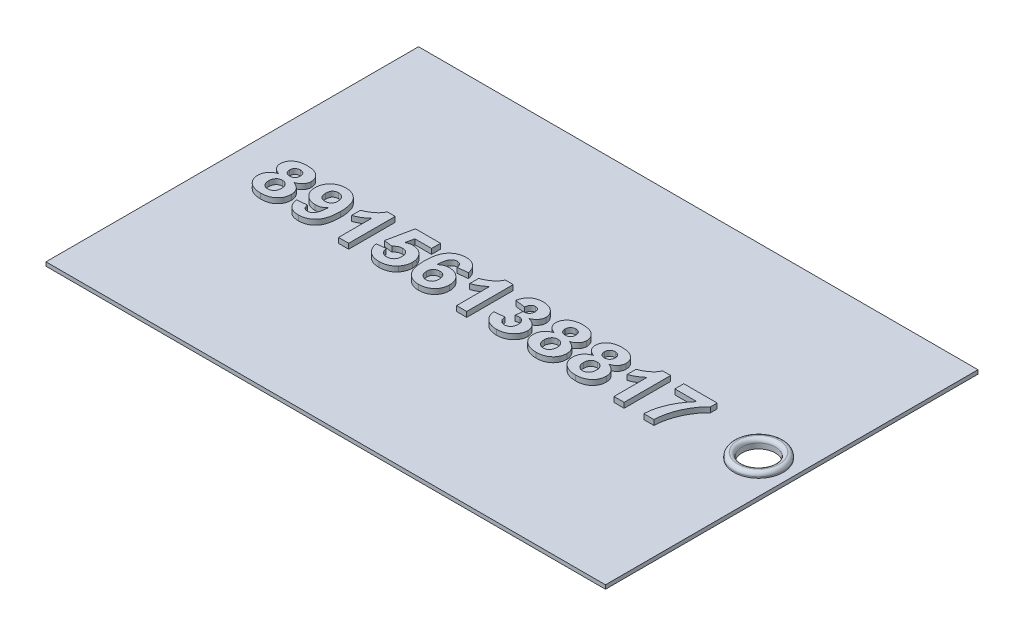
from build123d import *

# Parameters (mm, degrees)
SKETCH_1_W          = 86.5
SKETCH_1_H          = 57.6
EXTRUDE_1_DEPTH     = 0.6
EXTRUDE_2_DEPTH     = 0.8
SKETCH_4_R          = 3.817561334
EXTRUDE_3_DEPTH     = 0.8
SKETCH_6_R          = 2.57898752
CUT_EXTRUDE_1_DEPTH = 1.8
FILLET_1_R          = 0.6


with BuildPart() as part:
    # Эскиз1 → Бобышка-Вытянуть1 (new body)
    with BuildSketch(Plane(origin=(0, 0, 0), x_dir=(1, 0, 0), z_dir=(0, 1, 0))):
        Rectangle(SKETCH_1_W, SKETCH_1_H)
    extrude(amount=EXTRUDE_1_DEPTH)

    # Эскиз2 → Бобышка-Вытянуть2 (add)
    # profile 1 of 11: a face of its own
    with BuildSketch(Plane(origin=(0, 0.6, 0), x_dir=(1, 0, 0), z_dir=(0, 1, 0))):
        with BuildLine():
            add(Edge.make_bspline(
                [(-36.285548398, 0.189662229), (-36.336217326, 0.208249515), (-36.435329018, 0.244607445), (-36.576636112, 0.308436742), (-36.707435743, 0.376604952), (-36.826370801, 0.451592864), (-36.937086754, 0.528059561), (-37.034487713, 0.614103649), (-37.123125063, 0.70282966), (-37.224040922, 0.827712646), (-37.328587221, 0.991967456), (-37.416710796, 1.203180728), (-37.475337374, 1.422983015), (-37.481160232, 1.574149403), (-37.484097118, 1.650393481)],
                knots=[0, 0, 0, 0, 0.958286053, 1.874469368, 2.751924474, 3.575500876, 4.37063306, 5.138446985, 5.88024205, 6.595529584, 7.986847543, 9.320617915, 10.648594961, 12, 12, 12, 12], degree=3))
            add(Edge.make_bspline(
                [(-37.484097118, 1.650393481), (-37.482090341, 1.714839157), (-37.478146025, 1.841506974), (-37.449070542, 2.027277931), (-37.399284622, 2.204302041), (-37.332164765, 2.373660858), (-37.243122203, 2.533595618), (-37.133650181, 2.683858537), (-37.006933234, 2.82689857), (-36.860638307, 2.959716616), (-36.696842178, 3.080367811), (-36.515708278, 3.18664285), (-36.316738031, 3.27331835), (-36.102845759, 3.347967004), (-35.871471108, 3.402834049), (-35.624587499, 3.443454052), (-35.361118613, 3.465853718), (-35.180195806, 3.469425628), (-35.086999679, 3.471265574)],
                knots=[0, 0, 0, 0, 0.914682978, 1.797807145, 2.66113592, 3.520634732, 4.378049579, 5.252103346, 6.155026356, 7.086322986, 8.051602039, 9.038352878, 10.060630283, 11.127721113, 12.250325884, 13.431504408, 14.676928322, 16, 16, 16, 16], degree=3))
            add(Edge.make_bspline(
                [(-35.086999679, 3.471265574), (-34.994763518, 3.469415878), (-34.815279083, 3.46581651), (-34.553732859, 3.443440745), (-34.30825552, 3.402901597), (-34.077973469, 3.347648698), (-33.864746878, 3.27375674), (-33.666356278, 3.185882245), (-33.484369219, 3.080462965), (-33.319151911, 2.959731844), (-33.171535421, 2.826857625), (-33.043111098, 2.684362502), (-32.933970342, 2.533173195), (-32.843322986, 2.373768387), (-32.774425848, 2.204595456), (-32.725021175, 2.027245339), (-32.695829052, 1.841515542), (-32.691900829, 1.714842046), (-32.689902239, 1.650393481)],
                knots=[0, 0, 0, 0, 1.310519152, 2.550168893, 3.725584358, 4.842483071, 5.910449356, 6.927336827, 7.920794406, 8.892366141, 9.829481644, 10.737692221, 11.612463073, 12.473910606, 13.336680849, 14.20071791, 15.084566604, 16, 16, 16, 16], degree=3))
            add(Edge.make_bspline(
                [(-32.689902239, 1.650393481), (-32.690445519, 1.609992), (-32.691523553, 1.529823053), (-32.708926686, 1.411499157), (-32.732438663, 1.296043914), (-32.767703705, 1.184316651), (-32.812001605, 1.076059623), (-32.867783832, 0.972195339), (-32.930986109, 0.870134286), (-33.031693639, 0.740013934), (-33.178902269, 0.587025369), (-33.389707712, 0.430264756), (-33.630252172, 0.292839731), (-33.807196873, 0.224789461), (-33.898534903, 0.189662229)],
                knots=[0, 0, 0, 0, 0.715878892, 1.420523609, 2.117092496, 2.804014019, 3.495199071, 4.188584521, 4.892765842, 5.621847554, 7.103549966, 8.641724018, 10.266473608, 12, 12, 12, 12], degree=3))
            add(Edge.make_bspline(
                [(-33.898534903, 0.189662229), (-33.843051365, 0.169201246), (-33.734127381, 0.129032723), (-33.578444817, 0.058636223), (-33.434041023, -0.02037624), (-33.297532557, -0.102439146), (-33.173959099, -0.196221894), (-33.058428931, -0.293215312), (-32.953224389, -0.397786907), (-32.860789715, -0.510300124), (-32.775896521, -0.626787716), (-32.70504775, -0.749777203), (-32.641139621, -0.875238493), (-32.593480477, -1.006888546), (-32.553893653, -1.141969187), (-32.524608282, -1.281514401), (-32.509222431, -1.426300492), (-32.506757544, -1.524095689), (-32.505510129, -1.57358733)],
                knots=[0, 0, 0, 0, 1.177311303, 2.311270056, 3.397924368, 4.45402987, 5.479033016, 6.482948128, 7.456535392, 8.427348562, 9.379909235, 10.322823475, 11.25073535, 12.179582744, 13.105522015, 14.052499726, 15.014420052, 16, 16, 16, 16], degree=3))
            add(Edge.make_bspline(
                [(-32.505510129, -1.57358733), (-32.507940018, -1.654346328), (-32.51271753, -1.813130167), (-32.543885711, -2.045650498), (-32.599602407, -2.265870339), (-32.674303565, -2.475565792), (-32.772586162, -2.673237646), (-32.893303308, -2.859009058), (-33.035500939, -3.032707319), (-33.197866972, -3.193296371), (-33.377813429, -3.338644341), (-33.572941125, -3.466301155), (-33.783452855, -3.572847711), (-34.007518874, -3.66136674), (-34.246635953, -3.728438447), (-34.499502869, -3.777542272), (-34.767007995, -3.806359166), (-34.950076175, -3.81023757), (-35.043782778, -3.812222799)],
                knots=[0, 0, 0, 0, 1.018464953, 2.00244899, 2.951201689, 3.87829569, 4.804459757, 5.72824528, 6.666426589, 7.629849071, 8.602985074, 9.578811512, 10.56458265, 11.573243485, 12.61213359, 13.691648752, 14.818430642, 16, 16, 16, 16], degree=3))
            add(Edge.make_bspline(
                [(-35.043782778, -3.812222799), (-35.131222507, -3.81036797), (-35.302565562, -3.806733329), (-35.554443769, -3.783941144), (-35.794731837, -3.743844688), (-36.023845072, -3.687191505), (-36.242293185, -3.61610555), (-36.44837178, -3.525069862), (-36.646103988, -3.423478099), (-36.767047724, -3.33963956), (-36.827200224, -3.297941677)],
                knots=[0, 0, 0, 0, 1.112070826, 2.179165159, 3.213263291, 4.207123208, 5.178514106, 6.130358073, 7.070116082, 8, 8, 8, 8], degree=3))
            add(Edge.make_bspline(
                [(-36.827200224, -3.297941677), (-36.894503104, -3.246849777), (-37.026548489, -3.146609646), (-37.195506623, -2.969274872), (-37.344520638, -2.783371637), (-37.462066126, -2.579658255), (-37.556486398, -2.363082996), (-37.61917552, -2.131411253), (-37.662204859, -1.886821), (-37.666359145, -1.718801382), (-37.668489229, -1.632650428)],
                knots=[0, 0, 0, 0, 1.042160326, 2.04467415, 3.016482646, 3.978868424, 4.940760526, 5.926641304, 6.936898956, 8, 8, 8, 8], degree=3))
            add(Edge.make_bspline(
                [(-37.668489229, -1.632650428), (-37.667143745, -1.584602195), (-37.6644739, -1.489260005), (-37.650353513, -1.34754424), (-37.624524559, -1.208678542), (-37.586095233, -1.07341198), (-37.540688476, -0.939913778), (-37.482793766, -0.810509297), (-37.414016998, -0.684435541), (-37.337283421, -0.560527793), (-37.247741226, -0.442278845), (-37.145968536, -0.330481853), (-37.032054799, -0.225638695), (-36.906671624, -0.127308614), (-36.768225101, -0.037766451), (-36.618205594, 0.045161456), (-36.457339475, 0.123990706), (-36.343545893, 0.167491207), (-36.285548398, 0.189662229)],
                knots=[0, 0, 0, 0, 0.941336221, 1.867895066, 2.786591011, 3.703937775, 4.620126515, 5.546494376, 6.476579351, 7.431723818, 8.398651547, 9.377446652, 10.389175869, 11.427786824, 12.494800566, 13.614846226, 14.784351964, 16, 16, 16, 16], degree=3))
        make_face()
        with BuildLine():
            add(Edge.make_bspline(
                [(-35.916764177, 1.542351229), (-35.914096044, 1.48017872), (-35.908982217, 1.361016953), (-35.867601377, 1.192412545), (-35.795134731, 1.045952083), (-35.696662596, 0.92155053), (-35.572061554, 0.82440657), (-35.428406429, 0.7541168), (-35.265424182, 0.713332978), (-35.151100749, 0.708113279), (-35.091321369, 0.705383914)],
                knots=[0, 0, 0, 0, 1.121972408, 2.150407259, 3.108278179, 4.052191964, 4.990713166, 5.936974058, 6.921249925, 8, 8, 8, 8], degree=3))
            add(Edge.make_bspline(
                [(-35.091321369, 0.705383914), (-35.0310374, 0.708013309), (-34.915135388, 0.713068587), (-34.750969824, 0.755407169), (-34.605527694, 0.825975259), (-34.480770781, 0.924452138), (-34.379923784, 1.048903565), (-34.30675944, 1.195690309), (-34.264744147, 1.364798911), (-34.259822528, 1.484005001), (-34.25723518, 1.546672919)],
                knots=[0, 0, 0, 0, 1.079689513, 2.075811998, 3.015368644, 3.959333422, 4.901962196, 5.864590356, 6.8773923, 8, 8, 8, 8], degree=3))
            add(Edge.make_bspline(
                [(-34.25723518, 1.546672919), (-34.259811207, 1.606016294), (-34.2647417, 1.719598992), (-34.307658021, 1.880943237), (-34.378901186, 2.023994422), (-34.479740633, 2.144860471), (-34.601113452, 2.244874184), (-34.744455713, 2.314190068), (-34.904918138, 2.357379702), (-35.018041343, 2.36233431), (-35.076915735, 2.36491291)],
                knots=[0, 0, 0, 0, 1.090784866, 2.087752606, 3.048321147, 4.009174319, 4.964441443, 5.921057094, 6.918024835, 8, 8, 8, 8], degree=3))
            add(Edge.make_bspline(
                [(-35.076915735, 2.36491291), (-35.138153799, 2.362290831), (-35.255471427, 2.357267547), (-35.421822746, 2.315107124), (-35.568419224, 2.243235524), (-35.692245111, 2.142973187), (-35.79371982, 2.021089437), (-35.864806092, 1.877444067), (-35.909559481, 1.715955311), (-35.914300126, 1.601724905), (-35.916764177, 1.542351229)],
                knots=[0, 0, 0, 0, 1.108272365, 2.123187401, 3.084171351, 4.043381648, 4.989083505, 5.934505219, 6.926415291, 8, 8, 8, 8], degree=3))
        make_face(mode=Mode.SUBTRACT)
        with BuildLine():
            add(Edge.make_bspline(
                [(-36.101156288, -1.501559161), (-36.100517912, -1.547700824), (-36.099277669, -1.637345262), (-36.084168562, -1.767818384), (-36.061278165, -1.890614194), (-36.030407288, -2.006341166), (-35.987725597, -2.113487176), (-35.938026463, -2.213746372), (-35.876480996, -2.304830864), (-35.807605681, -2.388443902), (-35.731459074, -2.462890914), (-35.650539894, -2.528248671), (-35.565076196, -2.583331306), (-35.474905227, -2.628644822), (-35.379989905, -2.662925868), (-35.280482825, -2.687258039), (-35.176897373, -2.704260864), (-35.105797549, -2.705328359), (-35.069712918, -2.705870134)],
                knots=[0, 0, 0, 0, 1.241599918, 2.412191547, 3.530285543, 4.60283893, 5.630272913, 6.630426839, 7.609216693, 8.582442034, 9.542267977, 10.470946533, 11.378143532, 12.27422023, 13.18206171, 14.088152821, 15.029698039, 16, 16, 16, 16], degree=3))
            add(Edge.make_bspline(
                [(-35.069712918, -2.705870134), (-35.034619537, -2.70512215), (-34.965086426, -2.703640115), (-34.863504305, -2.689463199), (-34.766932059, -2.663837129), (-34.674476469, -2.631834949), (-34.58757203, -2.586932485), (-34.503549459, -2.536525731), (-34.426682367, -2.472380546), (-34.353395957, -2.401466425), (-34.287009193, -2.320434415), (-34.228730427, -2.230909259), (-34.181879195, -2.131479838), (-34.140837484, -2.02543272), (-34.111374564, -1.909680537), (-34.087870701, -1.786648546), (-34.075255514, -1.654520587), (-34.073662996, -1.564007197), (-34.07284307, -1.517405358)],
                knots=[0, 0, 0, 0, 0.962437785, 1.906949137, 2.804742188, 3.700600337, 4.584269373, 5.483510867, 6.38255937, 7.32338912, 8.278042554, 9.249989229, 10.245659391, 11.287906134, 12.364710024, 13.517024084, 14.721611888, 16, 16, 16, 16], degree=3))
            add(Edge.make_bspline(
                [(-34.07284307, -1.517405358), (-34.073672867, -1.47656049), (-34.075297783, -1.396577707), (-34.088033768, -1.279316984), (-34.111413714, -1.168090889), (-34.142744795, -1.062827415), (-34.183121935, -0.964271625), (-34.232955509, -0.872131552), (-34.291528168, -0.785888924), (-34.359763761, -0.707319797), (-34.432380741, -0.634626253), (-34.512498014, -0.573034785), (-34.596184757, -0.518679526), (-34.685867139, -0.475579924), (-34.780264437, -0.442621268), (-34.878959903, -0.417623083), (-34.982841531, -0.403085524), (-35.053821713, -0.401681843), (-35.089880805, -0.40096875)],
                knots=[0, 0, 0, 0, 1.155918347, 2.263529552, 3.33235739, 4.368544216, 5.367983109, 6.340920378, 7.328554279, 8.31178347, 9.282439969, 10.231253058, 11.166241316, 12.10231545, 13.039375653, 13.991977209, 14.979891594, 16, 16, 16, 16], degree=3))
            add(Edge.make_bspline(
                [(-35.089880805, -0.40096875), (-35.13122014, -0.402151266), (-35.21133457, -0.404442948), (-35.3274248, -0.419910674), (-35.434903894, -0.44789001), (-35.535105565, -0.484654002), (-35.626990849, -0.53449694), (-35.710640932, -0.595147345), (-35.786333712, -0.666224068), (-35.873481092, -0.774264079), (-35.963363966, -0.920609431), (-36.042284, -1.107598405), (-36.092131308, -1.302105399), (-36.098144813, -1.435005011), (-36.101156288, -1.501559161)],
                knots=[0, 0, 0, 0, 0.887516411, 1.719981036, 2.507577094, 3.267707935, 4.005706678, 4.743921389, 5.480478727, 6.227565498, 7.718071651, 9.150217807, 10.572871435, 12, 12, 12, 12], degree=3))
        make_face(mode=Mode.SUBTRACT)
    # profile 2 of 11: a face of its own
    with BuildSketch(Plane(origin=(0, 0.6, 0), x_dir=(1, 0, 0), z_dir=(0, 1, 0))):
        with BuildLine():
            Line((-31.399157464, -1.936609298), (-29.831824523, -1.783909581))
            add(Edge.make_bspline(
                [(-29.831824523, -1.783909581), (-29.821564595, -1.850054803), (-29.802171542, -1.975080793), (-29.747698967, -2.148352361), (-29.671713147, -2.294389344), (-29.574494704, -2.413789744), (-29.456788435, -2.50458782), (-29.321630608, -2.56856708), (-29.16978879, -2.606748116), (-29.063272585, -2.61130293), (-29.007822279, -2.613674079)],
                knots=[0, 0, 0, 0, 1.231193047, 2.327169275, 3.327745251, 4.244636558, 5.139439171, 6.041029258, 6.980197158, 8, 8, 8, 8], degree=3))
            add(Edge.make_bspline(
                [(-29.007822279, -2.613674079), (-28.971688482, -2.612884933), (-28.900266715, -2.611325113), (-28.79564049, -2.589175552), (-28.694479303, -2.558652712), (-28.598074653, -2.512544224), (-28.506186222, -2.455148506), (-28.41812306, -2.384623392), (-28.335624906, -2.300681812), (-28.253771166, -2.204366103), (-28.178856038, -2.086346885), (-28.114206466, -1.94217148), (-28.053891721, -1.773158707), (-28.000745932, -1.577687302), (-27.957651174, -1.355452715), (-27.91914837, -1.107470043), (-27.885202643, -0.83326315), (-27.871289173, -0.641145747), (-27.864014967, -0.540703397)],
                knots=[0, 0, 0, 0, 0.661879668, 1.308265946, 1.954892471, 2.597483001, 3.26258152, 3.939714808, 4.662557812, 5.419667133, 6.255744316, 7.217765111, 8.313252526, 9.546818957, 10.931172992, 12.46549124, 14.152096776, 16, 16, 16, 16], degree=3))
            add(Edge.make_bspline(
                [(-27.864014967, -0.540703397), (-27.912077522, -0.588293592), (-28.007337318, -0.682617174), (-28.164780232, -0.804931633), (-28.3315346, -0.908082145), (-28.507182071, -0.991583243), (-28.69053792, -1.059146252), (-28.884169137, -1.104047751), (-29.086077258, -1.134613171), (-29.224268784, -1.137215004), (-29.294494388, -1.138537193)],
                knots=[0, 0, 0, 0, 1.016554157, 2.014806384, 2.99086776, 3.959930652, 4.935430789, 5.923362918, 6.944703054, 8, 8, 8, 8], degree=3))
            add(Edge.make_bspline(
                [(-29.294494388, -1.138537193), (-29.370929704, -1.136511256), (-29.521946174, -1.132508526), (-29.744408577, -1.103382513), (-29.959066352, -1.054209545), (-30.165783838, -0.98511896), (-30.363700596, -0.895021852), (-30.554024203, -0.786422476), (-30.735380113, -0.656988684), (-30.909509506, -0.512138885), (-31.066047116, -0.348301262), (-31.206697516, -0.174011022), (-31.322211711, 0.015509487), (-31.417109257, 0.216118813), (-31.49296507, 0.427736667), (-31.545974891, 0.651374994), (-31.578362039, 0.88689803), (-31.581797653, 1.048132074), (-31.583549575, 1.130350106)],
                knots=[0, 0, 0, 0, 1.01884352, 2.012972034, 2.985091286, 3.950717898, 4.91336916, 5.87969577, 6.867227362, 7.88032292, 8.894449453, 9.883225206, 10.860390094, 11.84542865, 12.837576497, 13.851480752, 14.904406168, 16, 16, 16, 16], degree=3))
            add(Edge.make_bspline(
                [(-31.583549575, 1.130350106), (-31.581135419, 1.215909094), (-31.576398726, 1.383780036), (-31.545195387, 1.629164517), (-31.489822398, 1.861656075), (-31.413530503, 2.081475065), (-31.315436792, 2.289321284), (-31.193097387, 2.482540039), (-31.051429964, 2.664717155), (-30.886929142, 2.830030093), (-30.707784297, 2.981453567), (-30.514312487, 3.113070619), (-30.307654842, 3.22300507), (-30.090148815, 3.313716529), (-29.860620869, 3.384953228), (-29.619402367, 3.434706942), (-29.365896907, 3.465837738), (-29.192786968, 3.469430121), (-29.104340024, 3.471265574)],
                knots=[0, 0, 0, 0, 1.072024232, 2.103364261, 3.092786983, 4.061299559, 5.013985084, 5.965511011, 6.921155665, 7.899689109, 8.881878012, 9.856426617, 10.825443631, 11.809841357, 12.805118757, 13.831709527, 14.892156814, 16, 16, 16, 16], degree=3))
            add(Edge.make_bspline(
                [(-29.104340024, 3.471265574), (-29.008661189, 3.468802344), (-28.820331603, 3.463953839), (-28.544387055, 3.424906316), (-28.28218581, 3.357730728), (-28.032227736, 3.267402563), (-27.796590471, 3.148425708), (-27.573996486, 3.002797135), (-27.365499566, 2.83070865), (-27.168908229, 2.633724759), (-26.989492819, 2.406616685), (-26.837556478, 2.142788317), (-26.707713453, 1.846570165), (-26.601780783, 1.516830249), (-26.520619839, 1.153130398), (-26.462854899, 0.756351924), (-26.426117607, 0.325765591), (-26.422464709, 0.027437992), (-26.420570475, -0.127261711)],
                knots=[0, 0, 0, 0, 0.901643998, 1.774752374, 2.620046557, 3.449140987, 4.275016872, 5.10233027, 5.951360725, 6.818713095, 7.721447077, 8.670848442, 9.680069745, 10.76504824, 11.930062553, 13.188538504, 14.542098488, 16, 16, 16, 16], degree=3))
            add(Edge.make_bspline(
                [(-26.420570475, -0.127261711), (-26.422338153, -0.284370687), (-26.425754683, -0.588027529), (-26.464350915, -1.026255369), (-26.523203352, -1.430861038), (-26.607221207, -1.801922474), (-26.717940615, -2.138562924), (-26.85170813, -2.442422623), (-27.009782163, -2.71299869), (-27.194948703, -2.94759973), (-27.397992016, -3.151847925), (-27.616332696, -3.328739656), (-27.850077273, -3.477748935), (-28.097178436, -3.601646353), (-28.360281503, -3.694952557), (-28.637281481, -3.762465605), (-28.929141777, -3.80592374), (-29.12915314, -3.810095984), (-29.2311096, -3.812222799)],
                knots=[0, 0, 0, 0, 1.432153676, 2.768035743, 4.007693005, 5.15793701, 6.232359531, 7.233943367, 8.180075472, 9.081348856, 9.951322331, 10.801277852, 11.638106955, 12.474202681, 13.316238609, 14.177453051, 15.070950615, 16, 16, 16, 16], degree=3))
            add(Edge.make_bspline(
                [(-29.2311096, -3.812222799), (-29.304629942, -3.810884117), (-29.448160878, -3.80827066), (-29.658267565, -3.786576206), (-29.857252883, -3.749329132), (-30.044989984, -3.697160412), (-30.222517281, -3.632654987), (-30.389118684, -3.551603949), (-30.544372392, -3.454682661), (-30.690091794, -3.344911249), (-30.822782176, -3.219141434), (-30.942789149, -3.078163215), (-31.051289649, -2.923607542), (-31.146560439, -2.754129066), (-31.228337761, -2.570027786), (-31.29911797, -2.37226295), (-31.356724691, -2.159699585), (-31.384777381, -2.01221258), (-31.399157464, -1.936609298)],
                knots=[0, 0, 0, 0, 1.112623894, 2.17213286, 3.192787055, 4.173209248, 5.118323106, 6.047995836, 6.971740124, 7.884640988, 8.804947649, 9.732828744, 10.682542674, 11.658888362, 12.670653346, 13.728166063, 14.835435681, 16, 16, 16, 16], degree=3))
        make_face()
        with BuildLine():
            add(Edge.make_bspline(
                [(-27.987903416, 1.095776586), (-27.989225744, 1.141422065), (-27.991793575, 1.230061143), (-28.005426373, 1.359014349), (-28.031839292, 1.479493862), (-28.067792296, 1.592455358), (-28.113622187, 1.698027886), (-28.170578959, 1.795378626), (-28.236680076, 1.885304524), (-28.338337929, 1.991215341), (-28.47808328, 2.10308682), (-28.663198349, 2.202467214), (-28.862474222, 2.262560892), (-29.000216063, 2.269309339), (-29.069766503, 2.272716855)],
                knots=[0, 0, 0, 0, 0.91799807, 1.782662894, 2.60262069, 3.393412986, 4.162938389, 4.911402136, 5.65674597, 6.401151281, 7.857682046, 9.235448926, 10.60408614, 12, 12, 12, 12], degree=3))
            add(Edge.make_bspline(
                [(-29.069766503, 2.272716855), (-29.134890107, 2.269845668), (-29.261708514, 2.264254465), (-29.443101733, 2.215728382), (-29.606809189, 2.134504672), (-29.727350751, 2.041872269), (-29.813035699, 1.952232492), (-29.866982503, 1.87228354), (-29.913844889, 1.783551382), (-29.950831645, 1.684102156), (-29.981432683, 1.575371542), (-30.000479151, 1.455471874), (-30.014046542, 1.32657872), (-30.015478938, 1.236991786), (-30.016216634, 1.190853768)],
                knots=[0, 0, 0, 0, 1.431664542, 2.787951052, 4.097338494, 5.431366142, 6.111873526, 6.818476973, 7.546573036, 8.316072833, 9.149487248, 10.028760014, 10.984794968, 12, 12, 12, 12], degree=3))
            add(Edge.make_bspline(
                [(-30.016216634, 1.190853768), (-30.015599855, 1.143748654), (-30.014407174, 1.052660372), (-29.9992135, 0.920780596), (-29.977079507, 0.798695912), (-29.944950789, 0.686387119), (-29.904921073, 0.583120832), (-29.854822709, 0.48959384), (-29.794783982, 0.405738101), (-29.703055437, 0.309391902), (-29.572336421, 0.208732719), (-29.394611679, 0.123192974), (-29.199214208, 0.068888171), (-29.062451612, 0.063030209), (-28.991976082, 0.060011526)],
                knots=[0, 0, 0, 0, 0.979097379, 1.893303947, 2.757030447, 3.556730337, 4.31888723, 5.056103087, 5.757267517, 6.456651888, 7.816854138, 9.161164295, 10.537111332, 12, 12, 12, 12], degree=3))
            add(Edge.make_bspline(
                [(-28.991976082, 0.060011526), (-28.92389319, 0.062560024), (-28.791000558, 0.067534498), (-28.601569127, 0.120890486), (-28.427134399, 0.201424951), (-28.300146021, 0.298768398), (-28.209303611, 0.390075996), (-28.150445732, 0.468487791), (-28.099368497, 0.55429968), (-28.057718151, 0.648049407), (-28.025776004, 0.749553071), (-28.005388193, 0.858446618), (-27.989603383, 0.974316268), (-27.988482246, 1.054419973), (-27.987903416, 1.095776586)],
                knots=[0, 0, 0, 0, 1.500879801, 2.929603369, 4.315716618, 5.725035421, 6.437957177, 7.157483113, 7.885489455, 8.640828255, 9.419513109, 10.231197387, 11.086787741, 12, 12, 12, 12], degree=3))
        make_face(mode=Mode.SUBTRACT)
    # profile 3 of 11: a face of its own
    with BuildSketch(Plane(origin=(0, 0.6, 0), x_dir=(1, 0, 0), z_dir=(0, 1, 0))):
        with BuildLine():
            Line((-21.534179541, -3.720026743), (-23.101512483, -3.720026743))
            Line((-23.101512483, -3.720026743), (-23.101512483, 1.399735456))
            add(Edge.make_bspline(
                [(-23.101512483, 1.399735456), (-23.170876719, 1.335968894), (-23.30916301, 1.208842266), (-23.529622273, 1.033777172), (-23.756568001, 0.868147734), (-23.995546599, 0.719283567), (-24.241862355, 0.579740521), (-24.499007683, 0.455525377), (-24.763442871, 0.340037205), (-24.945946999, 0.276381615), (-25.037629645, 0.244403637)],
                knots=[0, 0, 0, 0, 0.994737277, 1.983133339, 2.971165072, 3.960250387, 4.954729103, 5.959447185, 6.974909315, 8, 8, 8, 8], degree=3))
            Line((-25.037629645, 0.244403637), (-25.037629645, 1.627344467))
            add(Edge.make_bspline(
                [(-25.037629645, 1.627344467), (-24.98696515, 1.642974822), (-24.883533586, 1.674884189), (-24.730106778, 1.736963454), (-24.571803695, 1.805616908), (-24.411537725, 1.886939606), (-24.246876579, 1.976120882), (-24.079220297, 2.075452993), (-23.910087644, 2.187635167), (-23.736948946, 2.304243226), (-23.570459666, 2.431094409), (-23.414689756, 2.563330525), (-23.271923796, 2.700311308), (-23.145801302, 2.845085536), (-23.031162167, 2.993070238), (-22.931519534, 3.147016989), (-22.843660843, 3.305249828), (-22.797506377, 3.41604775), (-22.774504599, 3.471265574)],
                knots=[0, 0, 0, 0, 0.84627656, 1.72767354, 2.640914771, 3.601075346, 4.596118427, 5.63104436, 6.711442709, 7.836547193, 8.963740039, 10.051595391, 11.098158957, 12.119560724, 13.114899202, 14.084716917, 15.045489645, 16, 16, 16, 16], degree=3))
            Line((-22.774504599, 3.471265574), (-21.534179541, 3.471265574))
            Line((-21.534179541, 3.471265574), (-21.534179541, -3.720026743))
        make_face()
    # profile 4 of 11: a face of its own
    with BuildSketch(Plane(origin=(0, 0.6, 0), x_dir=(1, 0, 0), z_dir=(0, 1, 0))):
        with BuildLine():
            Line((-19.321474213, -1.662902258), (-17.938533383, -1.507321415))
            add(Edge.make_bspline(
                [(-17.938533383, -1.507321415), (-17.925054172, -1.588708299), (-17.899029621, -1.745843401), (-17.8144169, -1.963917552), (-17.699894389, -2.156851815), (-17.551994924, -2.318943398), (-17.383448443, -2.450338555), (-17.19792075, -2.544156671), (-17.000483173, -2.603374463), (-16.863803952, -2.610216236), (-16.794726071, -2.613674079)],
                knots=[0, 0, 0, 0, 1.132713594, 2.186950245, 3.19787936, 4.203850097, 5.188585623, 6.122495558, 7.051106472, 8, 8, 8, 8], degree=3))
            add(Edge.make_bspline(
                [(-16.794726071, -2.613674079), (-16.754830097, -2.612958303), (-16.676206204, -2.611547708), (-16.560867191, -2.597003256), (-16.450688704, -2.572011771), (-16.344781854, -2.539205667), (-16.243451799, -2.495671182), (-16.14712719, -2.442324487), (-16.055382, -2.379747953), (-15.969082822, -2.307889707), (-15.889150935, -2.226547812), (-15.821992712, -2.132694851), (-15.761716363, -2.031817395), (-15.714296974, -1.919785724), (-15.678638754, -1.797825356), (-15.653129863, -1.66663701), (-15.636959157, -1.525966657), (-15.634764464, -1.429096482), (-15.633631999, -1.379111275)],
                knots=[0, 0, 0, 0, 0.99856367, 1.967891863, 2.904223222, 3.824437251, 4.740084433, 5.660298462, 6.577365375, 7.516394546, 8.46872226, 9.423399814, 10.398748969, 11.405960868, 12.459675593, 13.574970203, 14.748679695, 16, 16, 16, 16], degree=3))
            add(Edge.make_bspline(
                [(-15.633631999, -1.379111275), (-15.634247238, -1.332005976), (-15.63543694, -1.240917337), (-15.650651441, -1.109040061), (-15.672901326, -0.985906682), (-15.706069535, -0.87144291), (-15.749106088, -0.766149013), (-15.801579144, -0.670225822), (-15.861714756, -0.582633914), (-15.933336201, -0.506509576), (-16.011212707, -0.438678265), (-16.095182928, -0.379266351), (-16.185006196, -0.328703153), (-16.280320834, -0.286572145), (-16.381796176, -0.254629446), (-16.489210435, -0.234166905), (-16.601711908, -0.218385643), (-16.678940798, -0.217188128), (-16.718376213, -0.21657664)],
                knots=[0, 0, 0, 0, 1.251614926, 2.420277625, 3.524409861, 4.574763627, 5.582276091, 6.541991215, 7.476935319, 8.3983606, 9.312238547, 10.218955733, 11.127827072, 12.048102064, 12.984787544, 13.948653815, 14.95252041, 16, 16, 16, 16], degree=3))
            add(Edge.make_bspline(
                [(-16.718376213, -0.21657664), (-16.767944711, -0.218241885), (-16.866801525, -0.221562962), (-17.0124931, -0.24818996), (-17.154072371, -0.292011796), (-17.291614269, -0.353296804), (-17.425894949, -0.430872701), (-17.554671747, -0.527858641), (-17.680794821, -0.639941955), (-17.7578334, -0.725736127), (-17.797358173, -0.769752972)],
                knots=[0, 0, 0, 0, 0.949313125, 1.893260329, 2.827471212, 3.783183674, 4.772669257, 5.792158811, 6.867263355, 8, 8, 8, 8], degree=3))
            Line((-17.797358173, -0.769752972), (-19.137082102, -0.599766495))
            Line((-19.137082102, -0.599766495), (-18.307317604, 3.379069519))
            Line((-18.307317604, 3.379069519), (-14.435083279, 3.379069519))
            Line((-14.435083279, 3.379069519), (-14.435083279, 1.996128689))
            Line((-14.435083279, 1.996128689), (-17.012251139, 1.996128689))
            Line((-17.012251139, 1.996128689), (-17.297482685, 0.69962166))
            add(Edge.make_bspline(
                [(-17.297482685, 0.69962166), (-17.218839339, 0.743227524), (-17.065011649, 0.828521316), (-16.820354475, 0.915113875), (-16.574583662, 0.972422548), (-16.408969584, 0.978798667), (-16.326542977, 0.98197208)],
                knots=[0, 0, 0, 0, 1.053102438, 2.059885844, 3.034399571, 4, 4, 4, 4], degree=3))
            add(Edge.make_bspline(
                [(-16.326542977, 0.98197208), (-16.249134073, 0.980087773), (-16.096591184, 0.976374536), (-15.87269607, 0.94543562), (-15.658033997, 0.894893008), (-15.45191396, 0.824491417), (-15.255908331, 0.730928464), (-15.066904149, 0.620527419), (-14.889989448, 0.486096554), (-14.721419676, 0.336086996), (-14.568534695, 0.168518932), (-14.43334323, -0.01185884), (-14.320548575, -0.205707005), (-14.22634333, -0.410369917), (-14.15369886, -0.628218731), (-14.104826381, -0.85833844), (-14.071252467, -1.099620734), (-14.067971512, -1.264707259), (-14.066299058, -1.348859445)],
                knots=[0, 0, 0, 0, 1.022667739, 2.015280985, 2.980391415, 3.933662127, 4.887502983, 5.84633389, 6.82107698, 7.818708362, 8.824861166, 9.813571913, 10.79202628, 11.783076308, 12.786463574, 13.819630935, 14.88856572, 16, 16, 16, 16], degree=3))
            add(Edge.make_bspline(
                [(-14.066299058, -1.348859445), (-14.067997604, -1.41951295), (-14.071371587, -1.559858645), (-14.09721002, -1.767436892), (-14.143316022, -1.968823096), (-14.2023136, -2.165442188), (-14.283690078, -2.354716122), (-14.377697639, -2.540001081), (-14.492780019, -2.71816887), (-14.58064916, -2.830420128), (-14.625237643, -2.887381118)],
                knots=[0, 0, 0, 0, 1.014747606, 2.015688478, 2.997966958, 3.979712552, 4.959663584, 5.952970859, 6.961251668, 8, 8, 8, 8], degree=3))
            add(Edge.make_bspline(
                [(-14.625237643, -2.887381118), (-14.690343366, -2.961022834), (-14.819332164, -3.106923317), (-15.03992073, -3.295673324), (-15.278126995, -3.456060066), (-15.535467251, -3.585860643), (-15.810461999, -3.689311797), (-16.10513724, -3.76022339), (-16.417391621, -3.804472482), (-16.631789351, -3.8096005), (-16.741425226, -3.812222799)],
                knots=[0, 0, 0, 0, 0.985909348, 1.953303882, 2.905332073, 3.862631192, 4.840492358, 5.848410386, 6.899748567, 8, 8, 8, 8], degree=3))
            add(Edge.make_bspline(
                [(-16.741425226, -3.812222799), (-16.82936918, -3.810719823), (-17.00186133, -3.807771906), (-17.254371669, -3.78004352), (-17.49459382, -3.733650148), (-17.723050396, -3.671079963), (-17.938338977, -3.588324538), (-18.141482359, -3.489037699), (-18.331365553, -3.369825858), (-18.508197811, -3.233053965), (-18.670479964, -3.081242193), (-18.81547611, -2.915241778), (-18.944820358, -2.738191022), (-19.053669441, -2.546411777), (-19.148430177, -2.344020823), (-19.2243745, -2.128244957), (-19.284149931, -1.900332447), (-19.308901444, -1.742881151), (-19.321474213, -1.662902258)],
                knots=[0, 0, 0, 0, 1.13870103, 2.2334337, 3.284805762, 4.304808788, 5.296940231, 6.267613068, 7.228755926, 8.195295969, 9.158850228, 10.101936603, 11.046129622, 11.993389871, 12.953324756, 13.936842425, 14.951999352, 16, 16, 16, 16], degree=3))
        make_face()
    # profile 5 of 11: a face of its own
    with BuildSketch(Plane(origin=(0, 0.6, 0), x_dir=(1, 0, 0), z_dir=(0, 1, 0))):
        with BuildLine():
            Line((-8.350143626, 1.59421151), (-9.917476567, 1.442952357))
            add(Edge.make_bspline(
                [(-9.917476567, 1.442952357), (-9.926879762, 1.509686236), (-9.944625912, 1.635629538), (-10.002133932, 1.807734246), (-10.076011037, 1.954676283), (-10.174858965, 2.071891341), (-10.290568862, 2.163303085), (-10.423250877, 2.2276246), (-10.57179974, 2.265675857), (-10.675943351, 2.270312302), (-10.729954305, 2.272716855)],
                knots=[0, 0, 0, 0, 1.24815344, 2.35557362, 3.352034663, 4.281883764, 5.176746509, 6.069432672, 6.998769271, 8, 8, 8, 8], degree=3))
            add(Edge.make_bspline(
                [(-10.729954305, 2.272716855), (-10.766552279, 2.271868371), (-10.839367121, 2.270180238), (-10.945639101, 2.248769918), (-11.048240249, 2.21695543), (-11.146370633, 2.172482988), (-11.239522653, 2.113366214), (-11.328660969, 2.043158901), (-11.41308368, 1.959150984), (-11.495261683, 1.862564396), (-11.569747021, 1.743882844), (-11.637550169, 1.601599792), (-11.695435558, 1.431589413), (-11.746070997, 1.23532666), (-11.792700689, 1.013427371), (-11.82840542, 0.764502449), (-11.861228731, 0.489402041), (-11.874189137, 0.296347417), (-11.880964433, 0.195424483)],
                knots=[0, 0, 0, 0, 0.667223093, 1.327498168, 1.970791897, 2.625983588, 3.287654104, 3.980478248, 4.69342329, 5.458978853, 6.290746786, 7.243623896, 8.33053425, 9.563927688, 10.942903473, 12.467978657, 14.153569439, 16, 16, 16, 16], degree=3))
            add(Edge.make_bspline(
                [(-11.880964433, 0.195424483), (-11.833486553, 0.243605565), (-11.73964174, 0.338840328), (-11.582860588, 0.460451035), (-11.419069602, 0.565899043), (-11.246034842, 0.651034874), (-11.063989741, 0.715700392), (-10.874685392, 0.764125234), (-10.675992475, 0.791211909), (-10.540837646, 0.795432989), (-10.472093462, 0.797579969)],
                knots=[0, 0, 0, 0, 1.027880298, 2.031708983, 3.010350495, 3.987027629, 4.957375536, 5.944078772, 6.954290959, 8, 8, 8, 8], degree=3))
            add(Edge.make_bspline(
                [(-10.472093462, 0.797579969), (-10.39422661, 0.795529309), (-10.240833619, 0.791489632), (-10.014792894, 0.762885639), (-9.7976373, 0.71146276), (-9.588662026, 0.642672778), (-9.387674891, 0.554703757), (-9.197392551, 0.443474128), (-9.01356549, 0.315774), (-8.841764026, 0.167584438), (-8.68445521, 0.004696775), (-8.544275339, -0.170293064), (-8.427190161, -0.358580817), (-8.332282379, -0.55853281), (-8.256050303, -0.76907556), (-8.203691671, -0.991433441), (-8.170804299, -1.22542392), (-8.167461396, -1.385240261), (-8.165751515, -1.466985641)],
                knots=[0, 0, 0, 0, 1.034996023, 2.038879594, 3.02203398, 3.996948799, 4.960006787, 5.932222426, 6.922087842, 7.931495914, 8.942658201, 9.928543807, 10.906212864, 11.882610095, 12.865847357, 13.876788014, 14.913986076, 16, 16, 16, 16], degree=3))
            add(Edge.make_bspline(
                [(-8.165751515, -1.466985641), (-8.168104698, -1.553513), (-8.172696656, -1.72236084), (-8.204510315, -1.969543562), (-8.258940817, -2.203224928), (-8.336078101, -2.424237265), (-8.4337195, -2.632395905), (-8.554499812, -2.826884657), (-8.696639463, -3.007897289), (-8.858962518, -3.174473493), (-9.039227203, -3.323635592), (-9.232006276, -3.455610361), (-9.438836792, -3.565220638), (-9.656377004, -3.656836851), (-9.887565993, -3.72538508), (-10.130323868, -3.775955478), (-10.385833965, -3.806668463), (-10.560363242, -3.810348093), (-10.649282756, -3.812222799)],
                knots=[0, 0, 0, 0, 1.080953547, 2.10935214, 3.10763085, 4.073381176, 5.028771065, 5.974410373, 6.927329478, 7.898876365, 8.874416079, 9.84618522, 10.812438546, 11.794028718, 12.790448888, 13.819984307, 14.889321379, 16, 16, 16, 16], degree=3))
            add(Edge.make_bspline(
                [(-10.649282756, -3.812222799), (-10.744973972, -3.809831012), (-10.932376744, -3.805146911), (-11.207213064, -3.765384776), (-11.468902743, -3.699169691), (-11.717553851, -3.606645839), (-11.95353854, -3.488870704), (-12.176514336, -3.344680778), (-12.383822063, -3.170629263), (-12.581953407, -2.975297373), (-12.761171263, -2.7474795), (-12.913137441, -2.483750133), (-13.043088266, -2.188175053), (-13.147332889, -1.85853328), (-13.228624096, -1.496015742), (-13.286450838, -1.10019233), (-13.323145021, -0.67152673), (-13.326824995, -0.374637843), (-13.328730615, -0.22089833)],
                knots=[0, 0, 0, 0, 0.90354777, 1.769518291, 2.616597267, 3.449013198, 4.270544968, 5.103405658, 5.950727475, 6.823112593, 7.727752649, 8.679158623, 9.690510842, 10.772069633, 11.939543809, 13.196190923, 14.548089002, 16, 16, 16, 16], degree=3))
            add(Edge.make_bspline(
                [(-13.328730615, -0.22089833), (-13.326965019, -0.063308611), (-13.323552171, 0.241308079), (-13.284916696, 0.680961841), (-13.22618323, 1.087040678), (-13.141893384, 1.458813013), (-13.032803185, 1.796762414), (-12.899319708, 2.101123755), (-12.74094676, 2.372036987), (-12.555785166, 2.60662607), (-12.35279079, 2.81095746), (-12.134571522, 2.987284275), (-11.901917801, 3.137265229), (-11.655311231, 3.260264252), (-11.392982543, 3.354322458), (-11.116773936, 3.421282871), (-10.825939995, 3.465010423), (-10.626875292, 3.469153486), (-10.525394307, 3.471265574)],
                knots=[0, 0, 0, 0, 1.436220134, 2.776174909, 4.019893295, 5.174154615, 6.246979327, 7.252347525, 8.198275061, 9.099353575, 9.969138948, 10.818910695, 11.651874813, 12.487789761, 13.325525116, 14.18655335, 15.075524951, 16, 16, 16, 16], degree=3))
            add(Edge.make_bspline(
                [(-10.525394307, 3.471265574), (-10.454259348, 3.470059769), (-10.314480554, 3.467690385), (-10.109805996, 3.443817006), (-9.914242326, 3.406502595), (-9.727819554, 3.355132683), (-9.551116683, 3.287300444), (-9.38469377, 3.202891615), (-9.227051924, 3.104547276), (-9.078420588, 2.992416118), (-8.940969136, 2.865357579), (-8.816993327, 2.723479851), (-8.705625844, 2.568610453), (-8.607196654, 2.400341258), (-8.522039695, 2.21864512), (-8.452163307, 2.022389554), (-8.392259454, 1.813724519), (-8.364381514, 1.668421178), (-8.350143626, 1.59421151)],
                knots=[0, 0, 0, 0, 1.078697229, 2.119618824, 3.121076363, 4.096661226, 5.049017168, 5.98722759, 6.923059638, 7.864206387, 8.807493131, 9.757254739, 10.717517409, 11.696983403, 12.710449382, 13.756608287, 14.854249654, 16, 16, 16, 16], degree=3))
        make_face()
        with BuildLine():
            add(Edge.make_bspline(
                [(-11.761397674, -1.435293247), (-11.760063513, -1.480938618), (-11.757458757, -1.57005457), (-11.743836824, -1.699949818), (-11.717676801, -1.821456082), (-11.681514132, -1.934868122), (-11.635592093, -2.040356803), (-11.578908827, -2.138279343), (-11.51101909, -2.227210241), (-11.410047503, -2.333699616), (-11.269207708, -2.443852862), (-11.085118979, -2.543188878), (-10.88731846, -2.603397074), (-10.751004037, -2.610233996), (-10.682415713, -2.613674079)],
                knots=[0, 0, 0, 0, 0.918737652, 1.793701696, 2.623765471, 3.415194865, 4.185340234, 4.934406977, 5.686148635, 6.431153673, 7.882857164, 9.261734037, 10.622206884, 12, 12, 12, 12], degree=3))
            add(Edge.make_bspline(
                [(-10.682415713, -2.613674079), (-10.616771367, -2.610947115), (-10.489857974, -2.605674943), (-10.308714429, -2.555761262), (-10.144346574, -2.47747004), (-10.023008252, -2.385650458), (-9.938161309, -2.29621718), (-9.883139986, -2.216760049), (-9.835552795, -2.128048251), (-9.798775711, -2.028331464), (-9.767615462, -1.920241852), (-9.748985889, -1.801205228), (-9.735167816, -1.672830335), (-9.733795171, -1.583714708), (-9.733084456, -1.537573245)],
                knots=[0, 0, 0, 0, 1.444165147, 2.792074412, 4.108107338, 5.437521984, 6.118956735, 6.817840988, 7.561232448, 8.331780888, 9.15613387, 10.036604872, 10.983411488, 12, 12, 12, 12], degree=3))
            add(Edge.make_bspline(
                [(-9.733084456, -1.537573245), (-9.733711603, -1.489989812), (-9.734924718, -1.397947387), (-9.749938114, -1.265082683), (-9.772391125, -1.14208714), (-9.80448382, -1.028886662), (-9.84356383, -0.92462613), (-9.895411226, -0.831614212), (-9.953952931, -0.746784308), (-10.046184597, -0.650747885), (-10.17576715, -0.550097596), (-10.351531263, -0.461661337), (-10.547527608, -0.410478904), (-10.684035653, -0.404204808), (-10.754443882, -0.40096875)],
                knots=[0, 0, 0, 0, 0.987174034, 1.90952785, 2.771590932, 3.579338746, 4.349308432, 5.07634432, 5.784273485, 6.482310939, 7.832004586, 9.169201828, 10.539928653, 12, 12, 12, 12], degree=3))
            add(Edge.make_bspline(
                [(-10.754443882, -0.40096875), (-10.82246863, -0.40370488), (-10.955124396, -0.409040635), (-11.145876253, -0.459871166), (-11.320139439, -0.5428796), (-11.449109464, -0.639192209), (-11.539498588, -0.73096239), (-11.599228316, -0.80815804), (-11.649906802, -0.893177445), (-11.689725781, -0.987100115), (-11.724042301, -1.087301404), (-11.743888276, -1.19703919), (-11.759655248, -1.313350593), (-11.760806707, -1.393934801), (-11.761397674, -1.435293247)],
                knots=[0, 0, 0, 0, 1.49947167, 2.924135265, 4.323081227, 5.739554872, 6.451807762, 7.162243375, 7.8895667, 8.630214035, 9.411412667, 10.222335421, 11.08764452, 12, 12, 12, 12], degree=3))
        make_face(mode=Mode.SUBTRACT)
    # profile 6 of 11: a face of its own
    with BuildSketch(Plane(origin=(0, 0.6, 0), x_dir=(1, 0, 0), z_dir=(0, 1, 0))):
        with BuildLine():
            Line((-3.279360581, -3.720026743), (-4.846693522, -3.720026743))
            Line((-4.846693522, -3.720026743), (-4.846693522, 1.399735456))
            add(Edge.make_bspline(
                [(-4.846693522, 1.399735456), (-4.916057758, 1.335968894), (-5.05434405, 1.208842266), (-5.274803313, 1.033777172), (-5.501749041, 0.868147734), (-5.740727638, 0.719283567), (-5.987043395, 0.579740521), (-6.244188723, 0.455525377), (-6.50862391, 0.340037205), (-6.691128039, 0.276381615), (-6.782810685, 0.244403637)],
                knots=[0, 0, 0, 0, 0.994737277, 1.983133339, 2.971165072, 3.960250387, 4.954729103, 5.959447185, 6.974909315, 8, 8, 8, 8], degree=3))
            Line((-6.782810685, 0.244403637), (-6.782810685, 1.627344467))
            add(Edge.make_bspline(
                [(-6.782810685, 1.627344467), (-6.732146189, 1.642974822), (-6.628714625, 1.674884189), (-6.475287817, 1.736963454), (-6.316984734, 1.805616908), (-6.156718764, 1.886939606), (-5.992057618, 1.976120882), (-5.824401336, 2.075452993), (-5.655268683, 2.187635167), (-5.482129985, 2.304243226), (-5.315640706, 2.431094409), (-5.159870796, 2.563330525), (-5.017104835, 2.700311308), (-4.890982341, 2.845085536), (-4.776343206, 2.993070238), (-4.676700574, 3.147016989), (-4.588841883, 3.305249828), (-4.542687416, 3.41604775), (-4.519685638, 3.471265574)],
                knots=[0, 0, 0, 0, 0.84627656, 1.72767354, 2.640914771, 3.601075346, 4.596118427, 5.63104436, 6.711442709, 7.836547193, 8.963740039, 10.051595391, 11.098158957, 12.119560724, 13.114899202, 14.084716917, 15.045489645, 16, 16, 16, 16], degree=3))
            Line((-4.519685638, 3.471265574), (-3.279360581, 3.471265574))
            Line((-3.279360581, 3.471265574), (-3.279360581, -3.720026743))
        make_face()
    # profile 7 of 11: a face of its own
    with BuildSketch(Plane(origin=(0, 0.6, 0), x_dir=(1, 0, 0), z_dir=(0, 1, 0))):
        with BuildLine():
            Line((-1.158851308, -1.677307892), (0.408481633, -1.507321415))
            add(Edge.make_bspline(
                [(0.408481633, -1.507321415), (0.42062362, -1.592453305), (0.443723144, -1.754412463), (0.519715163, -1.977451952), (0.6161324, -2.172343372), (0.744340018, -2.331791345), (0.892674091, -2.457279486), (1.057085347, -2.549157996), (1.237637206, -2.60448506), (1.363194908, -2.610579162), (1.426959932, -2.613674079)],
                knots=[0, 0, 0, 0, 1.24129408, 2.361499839, 3.39286445, 4.371322553, 5.298019274, 6.187201151, 7.079362234, 8, 8, 8, 8], degree=3))
            add(Edge.make_bspline(
                [(1.426959932, -2.613674079), (1.462068761, -2.613010069), (1.530681066, -2.611712411), (1.631572299, -2.596581752), (1.728226906, -2.572363897), (1.82041981, -2.537762676), (1.907747001, -2.493479822), (1.992422515, -2.442121417), (2.070962469, -2.377850456), (2.146099922, -2.306009477), (2.214798298, -2.226359957), (2.274350783, -2.138731514), (2.325308441, -2.044898276), (2.36533783, -1.943079111), (2.396917621, -1.835020528), (2.419811918, -1.720322318), (2.434820729, -1.5994354), (2.436128082, -1.516491215), (2.436794851, -1.474188457)],
                knots=[0, 0, 0, 0, 0.986295755, 1.927493092, 2.860620514, 3.783339159, 4.688913558, 5.610446443, 6.561275604, 7.535113169, 8.530787542, 9.511803254, 10.508392348, 11.52615126, 12.5812739, 13.669387686, 14.811353348, 16, 16, 16, 16], degree=3))
            add(Edge.make_bspline(
                [(2.436794851, -1.474188457), (2.434234905, -1.395611209), (2.429341247, -1.245400969), (2.379167283, -1.033287855), (2.298932479, -0.845500898), (2.183485303, -0.68894956), (2.048555194, -0.560358944), (1.894798903, -0.467597785), (1.725066225, -0.411574054), (1.60697298, -0.404559279), (1.546526691, -0.40096875)],
                knots=[0, 0, 0, 0, 1.207401671, 2.308099339, 3.33389768, 4.328800241, 5.2804338, 6.185408085, 7.071197122, 8, 8, 8, 8], degree=3))
            add(Edge.make_bspline(
                [(1.546526691, -0.40096875), (1.503709065, -0.401948695), (1.413789034, -0.404006648), (1.273528487, -0.42690573), (1.120754066, -0.45754771), (1.016210871, -0.487578193), (0.961657965, -0.503248749)],
                knots=[0, 0, 0, 0, 0.861825513, 1.809894284, 2.85715536, 4, 4, 4, 4], degree=3))
            Line((0.961657965, -0.503248749), (1.091308668, 0.613187858))
            add(Edge.make_bspline(
                [(1.091308668, 0.613187858), (1.129739673, 0.612528607), (1.204314855, 0.611249334), (1.313216991, 0.620278322), (1.415152748, 0.636763238), (1.509884278, 0.663509924), (1.597499785, 0.695959116), (1.678765538, 0.736729108), (1.751693418, 0.787465259), (1.840487838, 0.864051211), (1.931332559, 0.978810673), (2.013461933, 1.136171675), (2.059222775, 1.315596488), (2.065012577, 1.441264316), (2.068010629, 1.506337145)],
                knots=[0, 0, 0, 0, 0.916749589, 1.778948191, 2.604102396, 3.376994206, 4.124053722, 4.831292757, 5.54010828, 6.238660037, 7.62386988, 9.002523041, 10.447858069, 12, 12, 12, 12], degree=3))
            add(Edge.make_bspline(
                [(2.068010629, 1.506337145), (2.065989341, 1.56174853), (2.062113668, 1.667995853), (2.027346252, 1.819180878), (1.9680055, 1.952658546), (1.88500134, 2.06611194), (1.783183083, 2.15823957), (1.664173533, 2.226315176), (1.527859825, 2.266012324), (1.43202586, 2.270426541), (1.382302468, 2.272716855)],
                knots=[0, 0, 0, 0, 1.146968804, 2.199229744, 3.192297141, 4.153502289, 5.090509175, 6.0173182, 6.971286811, 8, 8, 8, 8], degree=3))
            add(Edge.make_bspline(
                [(1.382302468, 2.272716855), (1.33245378, 2.270252684), (1.234468532, 2.265408977), (1.094258753, 2.217497035), (0.964907713, 2.143365782), (0.850764714, 2.037202934), (0.751834502, 1.905163605), (0.67517073, 1.744131561), (0.621180438, 1.556629684), (0.602624992, 1.421676717), (0.592873744, 1.350756301)],
                knots=[0, 0, 0, 0, 0.889956214, 1.749345552, 2.62404616, 3.543272128, 4.520224035, 5.562553653, 6.719074424, 8, 8, 8, 8], degree=3))
            Line((0.592873744, 1.350756301), (-0.974459197, 1.558197426))
            add(Edge.make_bspline(
                [(-0.974459197, 1.558197426), (-0.949825093, 1.663834347), (-0.902593235, 1.866375828), (-0.80649406, 2.15011605), (-0.691283187, 2.400004548), (-0.557144827, 2.619661131), (-0.39889205, 2.812551081), (-0.212430264, 2.979886259), (0.000282672, 3.127053192), (0.239438377, 3.249600768), (0.499831308, 3.348591298), (0.777841021, 3.421142031), (1.071791282, 3.462882924), (1.272688328, 3.468435193), (1.375099651, 3.471265574)],
                knots=[0, 0, 0, 0, 1.170378525, 2.244008991, 3.227240058, 4.134898305, 5.014904099, 5.910269448, 6.830450549, 7.799479806, 8.803503271, 9.831875844, 10.894754959, 12, 12, 12, 12], degree=3))
            add(Edge.make_bspline(
                [(1.375099651, 3.471265574), (1.462584424, 3.469414442), (1.633776336, 3.46579211), (1.883519161, 3.435012327), (2.119928836, 3.384911107), (2.342869513, 3.314060027), (2.553550191, 3.2235073), (2.749442281, 3.109698107), (2.934716024, 2.979553078), (3.044428182, 2.876259314), (3.099453999, 2.824452624)],
                knots=[0, 0, 0, 0, 1.109691721, 2.171466408, 3.18721329, 4.171840007, 5.135065248, 6.090279757, 7.042185312, 8, 8, 8, 8], degree=3))
            add(Edge.make_bspline(
                [(3.099453999, 2.824452624), (3.142092251, 2.780557933), (3.225988501, 2.694189481), (3.334633678, 2.554161164), (3.428751719, 2.410838478), (3.502958939, 2.26185439), (3.563294707, 2.109907383), (3.605231712, 1.952841062), (3.630001, 1.791401338), (3.633558152, 1.68217016), (3.635343571, 1.627344467)],
                knots=[0, 0, 0, 0, 1.088656038, 2.142070887, 3.149820329, 4.136167955, 5.099767227, 6.055714384, 7.024117403, 8, 8, 8, 8], degree=3))
            add(Edge.make_bspline(
                [(3.635343571, 1.627344467), (3.631749322, 1.55018075), (3.624647009, 1.397703604), (3.56774347, 1.175946812), (3.475329418, 0.966200433), (3.345328762, 0.768685786), (3.177158416, 0.584796978), (2.972175682, 0.414960441), (2.733732958, 0.253298368), (2.555586657, 0.163172879), (2.462724991, 0.116193498)],
                knots=[0, 0, 0, 0, 0.913502455, 1.805100266, 2.694334104, 3.619250939, 4.594228411, 5.636159153, 6.767809386, 8, 8, 8, 8], degree=3))
            add(Edge.make_bspline(
                [(2.462724991, 0.116193498), (2.520065372, 0.104550701), (2.632370373, 0.081747498), (2.795242917, 0.033646498), (2.948544275, -0.025386175), (3.093846595, -0.093095162), (3.229654726, -0.171262097), (3.357540343, -0.259151623), (3.475007048, -0.35924168), (3.585142136, -0.4664783), (3.682344758, -0.583620276), (3.769740844, -0.705494338), (3.841830986, -0.834832328), (3.901325575, -0.969343661), (3.94740567, -1.10979025), (3.981166273, -1.256262369), (3.999255142, -1.408910237), (4.00249198, -1.512561391), (4.004127792, -1.564943949)],
                knots=[0, 0, 0, 0, 1.127693224, 2.208663221, 3.269504195, 4.292462587, 5.296093002, 6.28739265, 7.279556553, 8.268085509, 9.247205498, 10.210439656, 11.155528465, 12.096481795, 13.042114592, 14.001112773, 14.989815125, 16, 16, 16, 16], degree=3))
            add(Edge.make_bspline(
                [(4.004127792, -1.564943949), (4.001950117, -1.641420006), (3.997653998, -1.792291996), (3.962404258, -2.014284693), (3.902925352, -2.227235813), (3.820306001, -2.431647398), (3.714339186, -2.627228719), (3.585090783, -2.813861256), (3.432767011, -2.992153389), (3.25786927, -3.158702592), (3.06704697, -3.31188903), (2.861689823, -3.445434346), (2.645971738, -3.559544634), (2.417601103, -3.652173607), (2.178455685, -3.724475406), (1.92743402, -3.773703346), (1.666036744, -3.807235214), (1.487572901, -3.810540111), (1.396708101, -3.812222799)],
                knots=[0, 0, 0, 0, 0.957612096, 1.889177468, 2.8071469, 3.721957718, 4.645115235, 5.587819211, 6.560594512, 7.577361403, 8.608825385, 9.621527474, 10.641279114, 11.661101714, 12.703921028, 13.765617522, 14.862364999, 16, 16, 16, 16], degree=3))
            add(Edge.make_bspline(
                [(1.396708101, -3.812222799), (1.310661237, -3.810887199), (1.141422105, -3.80826031), (0.893969095, -3.778000549), (0.65714927, -3.732706022), (0.432306298, -3.667289219), (0.217277792, -3.585997657), (0.015308064, -3.482017056), (-0.177355949, -3.363327969), (-0.355167878, -3.224292758), (-0.519807773, -3.072185061), (-0.666553229, -2.906352895), (-0.795959829, -2.729716645), (-0.906009996, -2.541440561), (-0.996791562, -2.341308911), (-1.070329859, -2.130710336), (-1.125926613, -1.908367134), (-1.147731263, -1.755346254), (-1.158851308, -1.677307892)],
                knots=[0, 0, 0, 0, 1.124230711, 2.21116517, 3.253861952, 4.273015247, 5.268543222, 6.253886906, 7.237970162, 8.222333653, 9.199465578, 10.164363217, 11.112287418, 12.057526777, 13.009764082, 13.980524197, 14.970097528, 16, 16, 16, 16], degree=3))
        make_face()
    # profile 8 of 11: a face of its own
    with BuildSketch(Plane(origin=(0, 0.6, 0), x_dir=(1, 0, 0), z_dir=(0, 1, 0))):
        with BuildLine():
            add(Edge.make_bspline(
                [(6.309029176, 0.189662229), (6.258360248, 0.208249515), (6.159248556, 0.244607445), (6.017941462, 0.308436742), (5.887141831, 0.376604952), (5.768206773, 0.451592864), (5.65749082, 0.528059561), (5.560089861, 0.614103649), (5.471452511, 0.70282966), (5.370536652, 0.827712646), (5.265990353, 0.991967456), (5.177866778, 1.203180728), (5.1192402, 1.422983015), (5.113417342, 1.574149403), (5.110480456, 1.650393481)],
                knots=[0, 0, 0, 0, 0.958286053, 1.874469368, 2.751924474, 3.575500876, 4.37063306, 5.138446985, 5.88024205, 6.595529584, 7.986847543, 9.320617915, 10.648594961, 12, 12, 12, 12], degree=3))
            add(Edge.make_bspline(
                [(5.110480456, 1.650393481), (5.112487234, 1.714839157), (5.11643155, 1.841506974), (5.145507032, 2.027277931), (5.195292952, 2.204302041), (5.262412809, 2.373660858), (5.351455371, 2.533595618), (5.460927393, 2.683858537), (5.58764434, 2.82689857), (5.733939267, 2.959716616), (5.897735396, 3.080367811), (6.078869296, 3.18664285), (6.277839543, 3.27331835), (6.491731815, 3.347967004), (6.723106466, 3.402834049), (6.969990075, 3.443454052), (7.233458961, 3.465853718), (7.414381768, 3.469425628), (7.507577895, 3.471265574)],
                knots=[0, 0, 0, 0, 0.914682978, 1.797807145, 2.66113592, 3.520634732, 4.378049579, 5.252103346, 6.155026356, 7.086322986, 8.051602039, 9.038352878, 10.060630283, 11.127721113, 12.250325884, 13.431504408, 14.676928322, 16, 16, 16, 16], degree=3))
            add(Edge.make_bspline(
                [(7.507577895, 3.471265574), (7.599814056, 3.469415878), (7.779298491, 3.46581651), (8.040844715, 3.443440745), (8.286322054, 3.402901597), (8.516604105, 3.347648698), (8.729830697, 3.27375674), (8.928221296, 3.185882245), (9.110208355, 3.080462965), (9.275425663, 2.959731844), (9.423042153, 2.826857625), (9.551466476, 2.684362502), (9.660607233, 2.533173195), (9.751254588, 2.373768387), (9.820151726, 2.204595456), (9.869556399, 2.027245339), (9.898748522, 1.841515542), (9.902676745, 1.714842046), (9.904675335, 1.650393481)],
                knots=[0, 0, 0, 0, 1.310519152, 2.550168893, 3.725584358, 4.842483071, 5.910449356, 6.927336827, 7.920794406, 8.892366141, 9.829481644, 10.737692221, 11.612463073, 12.473910606, 13.336680849, 14.20071791, 15.084566604, 16, 16, 16, 16], degree=3))
            add(Edge.make_bspline(
                [(9.904675335, 1.650393481), (9.904132055, 1.609992), (9.903054021, 1.529823053), (9.885650888, 1.411499157), (9.862138911, 1.296043914), (9.82687387, 1.184316651), (9.782575969, 1.076059623), (9.726793742, 0.972195339), (9.663591465, 0.870134286), (9.562883935, 0.740013934), (9.415675305, 0.587025369), (9.204869862, 0.430264756), (8.964325403, 0.292839731), (8.787380701, 0.224789461), (8.696042671, 0.189662229)],
                knots=[0, 0, 0, 0, 0.715878892, 1.420523609, 2.117092496, 2.804014019, 3.495199071, 4.188584521, 4.892765842, 5.621847554, 7.103549966, 8.641724018, 10.266473608, 12, 12, 12, 12], degree=3))
            add(Edge.make_bspline(
                [(8.696042671, 0.189662229), (8.751526209, 0.169201246), (8.860450193, 0.129032723), (9.016132757, 0.058636223), (9.160536551, -0.02037624), (9.297045018, -0.102439146), (9.420618476, -0.196221894), (9.536148643, -0.293215312), (9.641353185, -0.397786907), (9.733787859, -0.510300124), (9.818681053, -0.626787716), (9.889529824, -0.749777203), (9.953437953, -0.875238493), (10.001097097, -1.006888546), (10.040683921, -1.141969187), (10.069969292, -1.281514401), (10.085355144, -1.426300492), (10.08782003, -1.524095689), (10.089067445, -1.57358733)],
                knots=[0, 0, 0, 0, 1.177311303, 2.311270056, 3.397924368, 4.45402987, 5.479033016, 6.482948128, 7.456535392, 8.427348562, 9.379909235, 10.322823475, 11.25073535, 12.179582744, 13.105522015, 14.052499726, 15.014420052, 16, 16, 16, 16], degree=3))
            add(Edge.make_bspline(
                [(10.089067445, -1.57358733), (10.086637556, -1.654346328), (10.081860044, -1.813130167), (10.050691864, -2.045650498), (9.994975167, -2.265870339), (9.920274009, -2.475565792), (9.821991412, -2.673237646), (9.701274267, -2.859009058), (9.559076635, -3.032707319), (9.396710603, -3.193296371), (9.216764145, -3.338644341), (9.021636449, -3.466301155), (8.811124719, -3.572847711), (8.5870587, -3.66136674), (8.347941621, -3.728438447), (8.095074705, -3.777542272), (7.827569579, -3.806359166), (7.644501399, -3.81023757), (7.550794796, -3.812222799)],
                knots=[0, 0, 0, 0, 1.018464953, 2.00244899, 2.951201689, 3.87829569, 4.804459757, 5.72824528, 6.666426589, 7.629849071, 8.602985074, 9.578811512, 10.56458265, 11.573243485, 12.61213359, 13.691648752, 14.818430642, 16, 16, 16, 16], degree=3))
            add(Edge.make_bspline(
                [(7.550794796, -3.812222799), (7.463355067, -3.81036797), (7.292012012, -3.806733329), (7.040133806, -3.783941144), (6.799845737, -3.743844688), (6.570732502, -3.687191505), (6.352284389, -3.61610555), (6.146205794, -3.525069862), (5.948473586, -3.423478099), (5.82752985, -3.33963956), (5.767377351, -3.297941677)],
                knots=[0, 0, 0, 0, 1.112070826, 2.179165159, 3.213263291, 4.207123208, 5.178514106, 6.130358073, 7.070116082, 8, 8, 8, 8], degree=3))
            add(Edge.make_bspline(
                [(5.767377351, -3.297941677), (5.70007447, -3.246849777), (5.568029085, -3.146609646), (5.399070951, -2.969274872), (5.250056936, -2.783371637), (5.132511448, -2.579658255), (5.038091176, -2.363082996), (4.975402054, -2.131411253), (4.932372716, -1.886821), (4.928218429, -1.718801382), (4.926088345, -1.632650428)],
                knots=[0, 0, 0, 0, 1.042160326, 2.04467415, 3.016482646, 3.978868424, 4.940760526, 5.926641304, 6.936898956, 8, 8, 8, 8], degree=3))
            add(Edge.make_bspline(
                [(4.926088345, -1.632650428), (4.927433829, -1.584602195), (4.930103674, -1.489260005), (4.944224061, -1.34754424), (4.970053015, -1.208678542), (5.008482341, -1.07341198), (5.053889098, -0.939913778), (5.111783808, -0.810509297), (5.180560576, -0.684435541), (5.257294153, -0.560527793), (5.346836348, -0.442278845), (5.448609038, -0.330481853), (5.562522775, -0.225638695), (5.68790595, -0.127308614), (5.826352473, -0.037766451), (5.97637198, 0.045161456), (6.137238099, 0.123990706), (6.251031681, 0.167491207), (6.309029176, 0.189662229)],
                knots=[0, 0, 0, 0, 0.941336221, 1.867895066, 2.786591011, 3.703937775, 4.620126515, 5.546494376, 6.476579351, 7.431723818, 8.398651547, 9.377446652, 10.389175869, 11.427786824, 12.494800566, 13.614846226, 14.784351964, 16, 16, 16, 16], degree=3))
        make_face()
        with BuildLine():
            add(Edge.make_bspline(
                [(6.677813397, 1.542351229), (6.68048153, 1.48017872), (6.685595357, 1.361016953), (6.726976197, 1.192412545), (6.799442843, 1.045952083), (6.897914978, 0.92155053), (7.022516021, 0.82440657), (7.166171145, 0.7541168), (7.329153392, 0.713332978), (7.443476825, 0.708113279), (7.503256205, 0.705383914)],
                knots=[0, 0, 0, 0, 1.121972408, 2.150407259, 3.108278179, 4.052191964, 4.990713166, 5.936974058, 6.921249925, 8, 8, 8, 8], degree=3))
            add(Edge.make_bspline(
                [(7.503256205, 0.705383914), (7.563540174, 0.708013309), (7.679442186, 0.713068587), (7.843607751, 0.755407169), (7.98904988, 0.825975259), (8.113806793, 0.924452138), (8.21465379, 1.048903565), (8.287818135, 1.195690309), (8.329833427, 1.364798911), (8.334755046, 1.484005001), (8.337342394, 1.546672919)],
                knots=[0, 0, 0, 0, 1.079689513, 2.075811998, 3.015368644, 3.959333422, 4.901962196, 5.864590356, 6.8773923, 8, 8, 8, 8], degree=3))
            add(Edge.make_bspline(
                [(8.337342394, 1.546672919), (8.334766367, 1.606016294), (8.329835874, 1.719598992), (8.286919554, 1.880943237), (8.215676388, 2.023994422), (8.114836942, 2.144860471), (7.993464122, 2.244874184), (7.850121861, 2.314190068), (7.689659436, 2.357379702), (7.576536231, 2.36233431), (7.517661839, 2.36491291)],
                knots=[0, 0, 0, 0, 1.090784866, 2.087752606, 3.048321147, 4.009174319, 4.964441443, 5.921057094, 6.918024835, 8, 8, 8, 8], degree=3))
            add(Edge.make_bspline(
                [(7.517661839, 2.36491291), (7.456423775, 2.362290831), (7.339106147, 2.357267547), (7.172754828, 2.315107124), (7.02615835, 2.243235524), (6.902332463, 2.142973187), (6.800857754, 2.021089437), (6.729771482, 1.877444067), (6.685018093, 1.715955311), (6.680277448, 1.601724905), (6.677813397, 1.542351229)],
                knots=[0, 0, 0, 0, 1.108272365, 2.123187401, 3.084171351, 4.043381648, 4.989083505, 5.934505219, 6.926415291, 8, 8, 8, 8], degree=3))
        make_face(mode=Mode.SUBTRACT)
        with BuildLine():
            add(Edge.make_bspline(
                [(6.493421287, -1.501559161), (6.494059663, -1.547700824), (6.495299905, -1.637345262), (6.510409012, -1.767818384), (6.533299409, -1.890614194), (6.564170286, -2.006341166), (6.606851977, -2.113487176), (6.656551111, -2.213746372), (6.718096578, -2.304830864), (6.786971893, -2.388443902), (6.8631185, -2.462890914), (6.94403768, -2.528248671), (7.029501378, -2.583331306), (7.119672347, -2.628644822), (7.214587669, -2.662925868), (7.314094749, -2.687258039), (7.417680202, -2.704260864), (7.488780026, -2.705328359), (7.524864656, -2.705870134)],
                knots=[0, 0, 0, 0, 1.241599918, 2.412191547, 3.530285543, 4.60283893, 5.630272913, 6.630426839, 7.609216693, 8.582442034, 9.542267977, 10.470946533, 11.378143532, 12.27422023, 13.18206171, 14.088152821, 15.029698039, 16, 16, 16, 16], degree=3))
            add(Edge.make_bspline(
                [(7.524864656, -2.705870134), (7.559958037, -2.70512215), (7.629491148, -2.703640115), (7.731073269, -2.689463199), (7.827645515, -2.663837129), (7.920101105, -2.631834949), (8.007005544, -2.586932485), (8.091028116, -2.536525731), (8.167895207, -2.472380546), (8.241181617, -2.401466425), (8.307568381, -2.320434415), (8.365847147, -2.230909259), (8.412698379, -2.131479838), (8.45374009, -2.02543272), (8.483203011, -1.909680537), (8.506706873, -1.786648546), (8.51932206, -1.654520587), (8.520914578, -1.564007197), (8.521734504, -1.517405358)],
                knots=[0, 0, 0, 0, 0.962437785, 1.906949137, 2.804742188, 3.700600337, 4.584269373, 5.483510867, 6.38255937, 7.32338912, 8.278042554, 9.249989229, 10.245659391, 11.287906134, 12.364710024, 13.517024084, 14.721611888, 16, 16, 16, 16], degree=3))
            add(Edge.make_bspline(
                [(8.521734504, -1.517405358), (8.520904707, -1.47656049), (8.519279792, -1.396577707), (8.506543806, -1.279316984), (8.48316386, -1.168090889), (8.45183278, -1.062827415), (8.411455639, -0.964271625), (8.361622065, -0.872131552), (8.303049407, -0.785888924), (8.234813814, -0.707319797), (8.162196833, -0.634626253), (8.08207956, -0.573034785), (7.998392817, -0.518679526), (7.908710435, -0.475579924), (7.814313137, -0.442621268), (7.715617672, -0.417623083), (7.611736043, -0.403085524), (7.540755861, -0.401681843), (7.504696769, -0.40096875)],
                knots=[0, 0, 0, 0, 1.155918347, 2.263529552, 3.33235739, 4.368544216, 5.367983109, 6.340920378, 7.328554279, 8.31178347, 9.282439969, 10.231253058, 11.166241316, 12.10231545, 13.039375653, 13.991977209, 14.979891594, 16, 16, 16, 16], degree=3))
            add(Edge.make_bspline(
                [(7.504696769, -0.40096875), (7.463357434, -0.402151266), (7.383243004, -0.404442948), (7.267152774, -0.419910674), (7.159673681, -0.44789001), (7.059472009, -0.484654002), (6.967586725, -0.53449694), (6.883936642, -0.595147345), (6.808243862, -0.666224068), (6.721096482, -0.774264079), (6.631213608, -0.920609431), (6.552293574, -1.107598405), (6.502446266, -1.302105399), (6.496432761, -1.435005011), (6.493421287, -1.501559161)],
                knots=[0, 0, 0, 0, 0.887516411, 1.719981036, 2.507577094, 3.267707935, 4.005706678, 4.743921389, 5.480478727, 6.227565498, 7.718071651, 9.150217807, 10.572871435, 12, 12, 12, 12], degree=3))
        make_face(mode=Mode.SUBTRACT)
    # profile 9 of 11: a face of its own
    with BuildSketch(Plane(origin=(0, 0.6, 0), x_dir=(1, 0, 0), z_dir=(0, 1, 0))):
        with BuildLine():
            add(Edge.make_bspline(
                [(12.393968829, 0.189662229), (12.343299902, 0.208249515), (12.244188209, 0.244607445), (12.102881115, 0.308436742), (11.972081484, 0.376604952), (11.853146426, 0.451592864), (11.742430473, 0.528059561), (11.645029514, 0.614103649), (11.556392165, 0.70282966), (11.455476305, 0.827712646), (11.350930006, 0.991967456), (11.262806431, 1.203180728), (11.204179854, 1.422983015), (11.198356996, 1.574149403), (11.19542011, 1.650393481)],
                knots=[0, 0, 0, 0, 0.958286053, 1.874469368, 2.751924474, 3.575500876, 4.37063306, 5.138446985, 5.88024205, 6.595529584, 7.986847543, 9.320617915, 10.648594961, 12, 12, 12, 12], degree=3))
            add(Edge.make_bspline(
                [(11.19542011, 1.650393481), (11.197426887, 1.714839157), (11.201371203, 1.841506974), (11.230446685, 2.027277931), (11.280232605, 2.204302041), (11.347352462, 2.373660858), (11.436395025, 2.533595618), (11.545867046, 2.683858537), (11.672583994, 2.82689857), (11.81887892, 2.959716616), (11.98267505, 3.080367811), (12.16380895, 3.18664285), (12.362779196, 3.27331835), (12.576671469, 3.347967004), (12.808046119, 3.402834049), (13.054929729, 3.443454052), (13.318398614, 3.465853718), (13.499321421, 3.469425628), (13.592517549, 3.471265574)],
                knots=[0, 0, 0, 0, 0.914682978, 1.797807145, 2.66113592, 3.520634732, 4.378049579, 5.252103346, 6.155026356, 7.086322986, 8.051602039, 9.038352878, 10.060630283, 11.127721113, 12.250325884, 13.431504408, 14.676928322, 16, 16, 16, 16], degree=3))
            add(Edge.make_bspline(
                [(13.592517549, 3.471265574), (13.68475371, 3.469415878), (13.864238144, 3.46581651), (14.125784369, 3.443440745), (14.371261707, 3.402901597), (14.601543758, 3.347648698), (14.81477035, 3.27375674), (15.01316095, 3.185882245), (15.195148008, 3.080462965), (15.360365317, 2.959731844), (15.507981806, 2.826857625), (15.636406129, 2.684362502), (15.745546886, 2.533173195), (15.836194242, 2.373768387), (15.905091379, 2.204595456), (15.954496052, 2.027245339), (15.983688176, 1.841515542), (15.987616399, 1.714842046), (15.989614988, 1.650393481)],
                knots=[0, 0, 0, 0, 1.310519152, 2.550168893, 3.725584358, 4.842483071, 5.910449356, 6.927336827, 7.920794406, 8.892366141, 9.829481644, 10.737692221, 11.612463073, 12.473910606, 13.336680849, 14.20071791, 15.084566604, 16, 16, 16, 16], degree=3))
            add(Edge.make_bspline(
                [(15.989614988, 1.650393481), (15.989071708, 1.609992), (15.987993674, 1.529823053), (15.970590542, 1.411499157), (15.947078565, 1.296043914), (15.911813523, 1.184316651), (15.867515622, 1.076059623), (15.811733395, 0.972195339), (15.748531118, 0.870134286), (15.647823589, 0.740013934), (15.500614958, 0.587025369), (15.289809515, 0.430264756), (15.049265056, 0.292839731), (14.872320354, 0.224789461), (14.780982325, 0.189662229)],
                knots=[0, 0, 0, 0, 0.715878892, 1.420523609, 2.117092496, 2.804014019, 3.495199071, 4.188584521, 4.892765842, 5.621847554, 7.103549966, 8.641724018, 10.266473608, 12, 12, 12, 12], degree=3))
            add(Edge.make_bspline(
                [(14.780982325, 0.189662229), (14.836465862, 0.169201246), (14.945389847, 0.129032723), (15.10107241, 0.058636223), (15.245476205, -0.02037624), (15.381984671, -0.102439146), (15.505558129, -0.196221894), (15.621088296, -0.293215312), (15.726292838, -0.397786907), (15.818727513, -0.510300124), (15.903620706, -0.626787716), (15.974469477, -0.749777203), (16.038377607, -0.875238493), (16.08603675, -1.006888546), (16.125623574, -1.141969187), (16.154908945, -1.281514401), (16.170294797, -1.426300492), (16.172759683, -1.524095689), (16.174007099, -1.57358733)],
                knots=[0, 0, 0, 0, 1.177311303, 2.311270056, 3.397924368, 4.45402987, 5.479033016, 6.482948128, 7.456535392, 8.427348562, 9.379909235, 10.322823475, 11.25073535, 12.179582744, 13.105522015, 14.052499726, 15.014420052, 16, 16, 16, 16], degree=3))
            add(Edge.make_bspline(
                [(16.174007099, -1.57358733), (16.17157721, -1.654346328), (16.166799697, -1.813130167), (16.135631517, -2.045650498), (16.07991482, -2.265870339), (16.005213662, -2.475565792), (15.906931065, -2.673237646), (15.78621392, -2.859009058), (15.644016288, -3.032707319), (15.481650256, -3.193296371), (15.301703799, -3.338644341), (15.106576102, -3.466301155), (14.896064373, -3.572847711), (14.671998353, -3.66136674), (14.432881274, -3.728438447), (14.180014359, -3.777542272), (13.912509233, -3.806359166), (13.729441052, -3.81023757), (13.63573445, -3.812222799)],
                knots=[0, 0, 0, 0, 1.018464953, 2.00244899, 2.951201689, 3.87829569, 4.804459757, 5.72824528, 6.666426589, 7.629849071, 8.602985074, 9.578811512, 10.56458265, 11.573243485, 12.61213359, 13.691648752, 14.818430642, 16, 16, 16, 16], degree=3))
            add(Edge.make_bspline(
                [(13.63573445, -3.812222799), (13.54829472, -3.81036797), (13.376951665, -3.806733329), (13.125073459, -3.783941144), (12.88478539, -3.743844688), (12.655672155, -3.687191505), (12.437224042, -3.61610555), (12.231145448, -3.525069862), (12.033413239, -3.423478099), (11.912469503, -3.33963956), (11.852317004, -3.297941677)],
                knots=[0, 0, 0, 0, 1.112070826, 2.179165159, 3.213263291, 4.207123208, 5.178514106, 6.130358073, 7.070116082, 8, 8, 8, 8], degree=3))
            add(Edge.make_bspline(
                [(11.852317004, -3.297941677), (11.785014123, -3.246849777), (11.652968739, -3.146609646), (11.484010604, -2.969274872), (11.33499659, -2.783371637), (11.217451101, -2.579658255), (11.123030829, -2.363082996), (11.060341708, -2.131411253), (11.017312369, -1.886821), (11.013158082, -1.718801382), (11.011027999, -1.632650428)],
                knots=[0, 0, 0, 0, 1.042160326, 2.04467415, 3.016482646, 3.978868424, 4.940760526, 5.926641304, 6.936898956, 8, 8, 8, 8], degree=3))
            add(Edge.make_bspline(
                [(11.011027999, -1.632650428), (11.012373482, -1.584602195), (11.015043328, -1.489260005), (11.029163714, -1.34754424), (11.054992669, -1.208678542), (11.093421994, -1.07341198), (11.138828751, -0.939913778), (11.196723462, -0.810509297), (11.265500229, -0.684435541), (11.342233806, -0.560527793), (11.431776002, -0.442278845), (11.533548692, -0.330481853), (11.647462428, -0.225638695), (11.772845603, -0.127308614), (11.911292127, -0.037766451), (12.061311633, 0.045161456), (12.222177753, 0.123990706), (12.335971334, 0.167491207), (12.393968829, 0.189662229)],
                knots=[0, 0, 0, 0, 0.941336221, 1.867895066, 2.786591011, 3.703937775, 4.620126515, 5.546494376, 6.476579351, 7.431723818, 8.398651547, 9.377446652, 10.389175869, 11.427786824, 12.494800566, 13.614846226, 14.784351964, 16, 16, 16, 16], degree=3))
        make_face()
        with BuildLine():
            add(Edge.make_bspline(
                [(12.762753051, 1.542351229), (12.765421184, 1.48017872), (12.770535011, 1.361016953), (12.81191585, 1.192412545), (12.884382496, 1.045952083), (12.982854632, 0.92155053), (13.107455674, 0.82440657), (13.251110798, 0.7541168), (13.414093045, 0.713332978), (13.528416479, 0.708113279), (13.588195859, 0.705383914)],
                knots=[0, 0, 0, 0, 1.121972408, 2.150407259, 3.108278179, 4.052191964, 4.990713166, 5.936974058, 6.921249925, 8, 8, 8, 8], degree=3))
            add(Edge.make_bspline(
                [(13.588195859, 0.705383914), (13.648479828, 0.708013309), (13.764381839, 0.713068587), (13.928547404, 0.755407169), (14.073989533, 0.825975259), (14.198746447, 0.924452138), (14.299593444, 1.048903565), (14.372757788, 1.195690309), (14.41477308, 1.364798911), (14.419694699, 1.484005001), (14.422282047, 1.546672919)],
                knots=[0, 0, 0, 0, 1.079689513, 2.075811998, 3.015368644, 3.959333422, 4.901962196, 5.864590356, 6.8773923, 8, 8, 8, 8], degree=3))
            add(Edge.make_bspline(
                [(14.422282047, 1.546672919), (14.41970602, 1.606016294), (14.414775528, 1.719598992), (14.371859207, 1.880943237), (14.300616042, 2.023994422), (14.199776595, 2.144860471), (14.078403775, 2.244874184), (13.935061514, 2.314190068), (13.77459909, 2.357379702), (13.661475884, 2.36233431), (13.602601492, 2.36491291)],
                knots=[0, 0, 0, 0, 1.090784866, 2.087752606, 3.048321147, 4.009174319, 4.964441443, 5.921057094, 6.918024835, 8, 8, 8, 8], degree=3))
            add(Edge.make_bspline(
                [(13.602601492, 2.36491291), (13.541363429, 2.362290831), (13.424045801, 2.357267547), (13.257694481, 2.315107124), (13.111098004, 2.243235524), (12.987272117, 2.142973187), (12.885797408, 2.021089437), (12.814711136, 1.877444067), (12.769957747, 1.715955311), (12.765217101, 1.601724905), (12.762753051, 1.542351229)],
                knots=[0, 0, 0, 0, 1.108272365, 2.123187401, 3.084171351, 4.043381648, 4.989083505, 5.934505219, 6.926415291, 8, 8, 8, 8], degree=3))
        make_face(mode=Mode.SUBTRACT)
        with BuildLine():
            add(Edge.make_bspline(
                [(12.57836094, -1.501559161), (12.578999316, -1.547700824), (12.580239559, -1.637345262), (12.595348665, -1.767818384), (12.618239062, -1.890614194), (12.649109939, -2.006341166), (12.691791631, -2.113487176), (12.741490764, -2.213746372), (12.803036232, -2.304830864), (12.871911546, -2.388443902), (12.948058154, -2.462890914), (13.028977334, -2.528248671), (13.114441032, -2.583331306), (13.204612001, -2.628644822), (13.299527323, -2.662925868), (13.399034402, -2.687258039), (13.502619855, -2.704260864), (13.573719679, -2.705328359), (13.609804309, -2.705870134)],
                knots=[0, 0, 0, 0, 1.241599918, 2.412191547, 3.530285543, 4.60283893, 5.630272913, 6.630426839, 7.609216693, 8.582442034, 9.542267977, 10.470946533, 11.378143532, 12.27422023, 13.18206171, 14.088152821, 15.029698039, 16, 16, 16, 16], degree=3))
            add(Edge.make_bspline(
                [(13.609804309, -2.705870134), (13.644897691, -2.70512215), (13.714430802, -2.703640115), (13.816012923, -2.689463199), (13.912585169, -2.663837129), (14.005040758, -2.631834949), (14.091945197, -2.586932485), (14.175967769, -2.536525731), (14.252834861, -2.472380546), (14.32612127, -2.401466425), (14.392508035, -2.320434415), (14.4507868, -2.230909259), (14.497638032, -2.131479838), (14.538679743, -2.02543272), (14.568142664, -1.909680537), (14.591646526, -1.786648546), (14.604261714, -1.654520587), (14.605854232, -1.564007197), (14.606674158, -1.517405358)],
                knots=[0, 0, 0, 0, 0.962437785, 1.906949137, 2.804742188, 3.700600337, 4.584269373, 5.483510867, 6.38255937, 7.32338912, 8.278042554, 9.249989229, 10.245659391, 11.287906134, 12.364710024, 13.517024084, 14.721611888, 16, 16, 16, 16], degree=3))
            add(Edge.make_bspline(
                [(14.606674158, -1.517405358), (14.605844361, -1.47656049), (14.604219445, -1.396577707), (14.591483459, -1.279316984), (14.568103513, -1.168090889), (14.536772433, -1.062827415), (14.496395293, -0.964271625), (14.446561718, -0.872131552), (14.38798906, -0.785888924), (14.319753467, -0.707319797), (14.247136486, -0.634626253), (14.167019214, -0.573034785), (14.083332471, -0.518679526), (13.993650088, -0.475579924), (13.899252791, -0.442621268), (13.800557325, -0.417623083), (13.696675697, -0.403085524), (13.625695515, -0.401681843), (13.589636422, -0.40096875)],
                knots=[0, 0, 0, 0, 1.155918347, 2.263529552, 3.33235739, 4.368544216, 5.367983109, 6.340920378, 7.328554279, 8.31178347, 9.282439969, 10.231253058, 11.166241316, 12.10231545, 13.039375653, 13.991977209, 14.979891594, 16, 16, 16, 16], degree=3))
            add(Edge.make_bspline(
                [(13.589636422, -0.40096875), (13.548297088, -0.402151266), (13.468182657, -0.404442948), (13.352092428, -0.419910674), (13.244613334, -0.44789001), (13.144411663, -0.484654002), (13.052526378, -0.53449694), (12.968876295, -0.595147345), (12.893183515, -0.666224068), (12.806036136, -0.774264079), (12.716153261, -0.920609431), (12.637233228, -1.107598405), (12.58738592, -1.302105399), (12.581372414, -1.435005011), (12.57836094, -1.501559161)],
                knots=[0, 0, 0, 0, 0.887516411, 1.719981036, 2.507577094, 3.267707935, 4.005706678, 4.743921389, 5.480478727, 6.227565498, 7.718071651, 9.150217807, 10.572871435, 12, 12, 12, 12], degree=3))
        make_face(mode=Mode.SUBTRACT)
    # profile 10 of 11: a face of its own
    with BuildSketch(Plane(origin=(0, 0.6, 0), x_dir=(1, 0, 0), z_dir=(0, 1, 0))):
        with BuildLine():
            Line((21.060398033, -3.720026743), (19.493065092, -3.720026743))
            Line((19.493065092, -3.720026743), (19.493065092, 1.399735456))
            add(Edge.make_bspline(
                [(19.493065092, 1.399735456), (19.423700855, 1.335968894), (19.285414564, 1.208842266), (19.064955301, 1.033777172), (18.838009573, 0.868147734), (18.599030976, 0.719283567), (18.352715219, 0.579740521), (18.095569891, 0.455525377), (17.831134703, 0.340037205), (17.648630575, 0.276381615), (17.556947929, 0.244403637)],
                knots=[0, 0, 0, 0, 0.994737277, 1.983133339, 2.971165072, 3.960250387, 4.954729103, 5.959447185, 6.974909315, 8, 8, 8, 8], degree=3))
            Line((17.556947929, 0.244403637), (17.556947929, 1.627344467))
            add(Edge.make_bspline(
                [(17.556947929, 1.627344467), (17.607612425, 1.642974822), (17.711043989, 1.674884189), (17.864470796, 1.736963454), (18.022773879, 1.805616908), (18.183039849, 1.886939606), (18.347700995, 1.976120882), (18.515357277, 2.075452993), (18.684489931, 2.187635167), (18.857628628, 2.304243226), (19.024117908, 2.431094409), (19.179887818, 2.563330525), (19.322653778, 2.700311308), (19.448776272, 2.845085536), (19.563415408, 2.993070238), (19.66305804, 3.147016989), (19.750916731, 3.305249828), (19.797071198, 3.41604775), (19.820072975, 3.471265574)],
                knots=[0, 0, 0, 0, 0.84627656, 1.72767354, 2.640914771, 3.601075346, 4.596118427, 5.63104436, 6.711442709, 7.836547193, 8.963740039, 10.051595391, 11.098158957, 12.119560724, 13.114899202, 14.084716917, 15.045489645, 16, 16, 16, 16], degree=3))
            Line((19.820072975, 3.471265574), (21.060398033, 3.471265574))
            Line((21.060398033, 3.471265574), (21.060398033, -3.720026743))
        make_face()
    # profile 11 of 11: a face of its own
    with BuildSketch(Plane(origin=(0, 0.6, 0), x_dir=(1, 0, 0), z_dir=(0, 1, 0))):
        with BuildLine():
            Line((23.180907306, 1.996128689), (23.180907306, 3.379069519))
            Line((23.180907306, 3.379069519), (28.343886406, 3.379069519))
            Line((28.343886406, 3.379069519), (28.343886406, 2.36491291))
            add(Edge.make_bspline(
                [(28.343886406, 2.36491291), (28.289613202, 2.3150028), (28.178090375, 2.21244544), (28.016313947, 2.044946761), (27.852522672, 1.862695378), (27.689355154, 1.664139585), (27.524628017, 1.450652447), (27.360630787, 1.220915457), (27.195185759, 0.975776213), (27.028846748, 0.71782953), (26.869595085, 0.448578173), (26.715152017, 0.175177757), (26.575563715, -0.104852154), (26.441587523, -0.387430276), (26.320009071, -0.67518437), (26.207148638, -0.966645657), (26.104778498, -1.262149001), (26.013526966, -1.560320054), (25.931734447, -1.856217919), (25.861632305, -2.146112961), (25.79968834, -2.42716265), (25.752888758, -2.701377168), (25.715385428, -2.967511393), (25.686969221, -3.225384697), (25.672685167, -3.475440411), (25.671020367, -3.639340236), (25.6702008, -3.720026743)],
                knots=[0, 0, 0, 0, 0.779443147, 1.601632054, 2.460919126, 3.369701966, 4.318178473, 5.311483905, 6.353522541, 7.444999922, 8.556033577, 9.660645286, 10.764136321, 11.863414649, 12.966730475, 14.066102594, 15.167559499, 16.2724512, 17.362522502, 18.412901177, 19.425635144, 20.404721763, 21.353211858, 22.267114164, 23.146914857, 24, 24, 24, 24], degree=3))
            Line((25.6702008, -3.720026743), (24.102867859, -3.720026743))
            add(Edge.make_bspline(
                [(24.102867859, -3.720026743), (24.108347027, -3.597495964), (24.119370376, -3.350980463), (24.158724443, -2.981115992), (24.218619626, -2.609692763), (24.295936612, -2.236397858), (24.394678119, -1.861095865), (24.512333956, -1.48400236), (24.651998886, -1.105870464), (24.807820721, -0.727309358), (24.981430511, -0.352930163), (25.170617618, 0.012839493), (25.371838529, 0.369904598), (25.590034123, 0.715085219), (25.820599421, 1.051054355), (26.064220306, 1.377683834), (26.323341381, 1.693100333), (26.506338619, 1.895055692), (26.597923607, 1.996128689)],
                knots=[0, 0, 0, 0, 0.924502064, 1.859974213, 2.802090899, 3.759844673, 4.732714932, 5.726534752, 6.736651002, 7.770597397, 8.812026349, 9.846606274, 10.874399912, 11.900866656, 12.924059869, 13.945638039, 14.971849414, 16, 16, 16, 16], degree=3))
            Line((26.597923607, 1.996128689), (23.180907306, 1.996128689))
        make_face()
    extrude(amount=EXTRUDE_2_DEPTH)

    # Эскиз4 → Бобышка-Вытянуть3 (add)
    with BuildSketch(Plane(origin=(0, 0.6, 0), x_dir=(1, 0, 0), z_dir=(0, 1, 0))):
        with Locations((38.130274119, 0)):
            Circle(SKETCH_4_R)
    extrude(amount=EXTRUDE_3_DEPTH)

    # Эскиз6 → Вырез-Вытянуть1 (cut)
    with BuildSketch(Plane(origin=(0, 1.4, 0), x_dir=(1, 0, 0), z_dir=(0, 1, 0))):
        with Locations((38.130274119, 0)):
            Circle(SKETCH_6_R)
    extrude(amount=-CUT_EXTRUDE_1_DEPTH, mode=Mode.SUBTRACT)

    # Скругление1
    fillet_1_edges = [part.edges().sort_by_distance(p)[0] for p in [
        (34.312712784, 1.4, 0),
        (35.551286598, 1.4, 0),
    ]]
    fillet(fillet_1_edges, radius=FILLET_1_R)


solid = part.part
